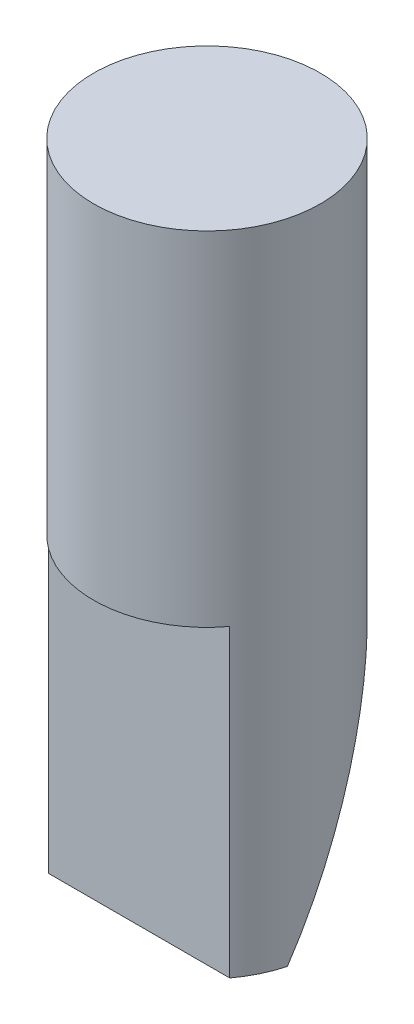
from build123d import *

# Parameters (mm, degrees)
SKIZZE1_R                            = 17.5
AUFSATZ_LINEAR_AUSTRAGEN1_DEPTH      = 100
SCHNITT_LINEAR_AUSTRAGEN1_DEPTH      = 104.01698889
SCHNITT_LINEAR_AUSTRAGEN1_DEPTH_BACK = 104.01698889
SKIZZE2_W                            = 7
SKIZZE2_H                            = 47


with BuildPart() as part:
    # Skizze1 → Aufsatz-Linear austragen1 (new body)
    with BuildSketch(Plane(origin=(0, 0, 0), x_dir=(1, 0, 0), z_dir=(0, 1, 0))):
        Circle(SKIZZE1_R)
    extrude(amount=AUFSATZ_LINEAR_AUSTRAGEN1_DEPTH)

    # Skizze2 → Schnitt-Linear austragen1 (cut, two sides: drawn at the far end of the back side and taken through both)
    with BuildSketch(Plane(origin=(0, 0, 0), x_dir=(0, 0, -1), z_dir=(1, 0, 0)).offset(-SCHNITT_LINEAR_AUSTRAGEN1_DEPTH_BACK)):
        with Locations((-14, 23.5)):
            Rectangle(SKIZZE2_W, SKIZZE2_H)
        Polygon((-4.5, 0), (17.5, 47), (17.5, 0), align=None)
    extrude(amount=SCHNITT_LINEAR_AUSTRAGEN1_DEPTH + SCHNITT_LINEAR_AUSTRAGEN1_DEPTH_BACK, mode=Mode.SUBTRACT)


solid = part.part
